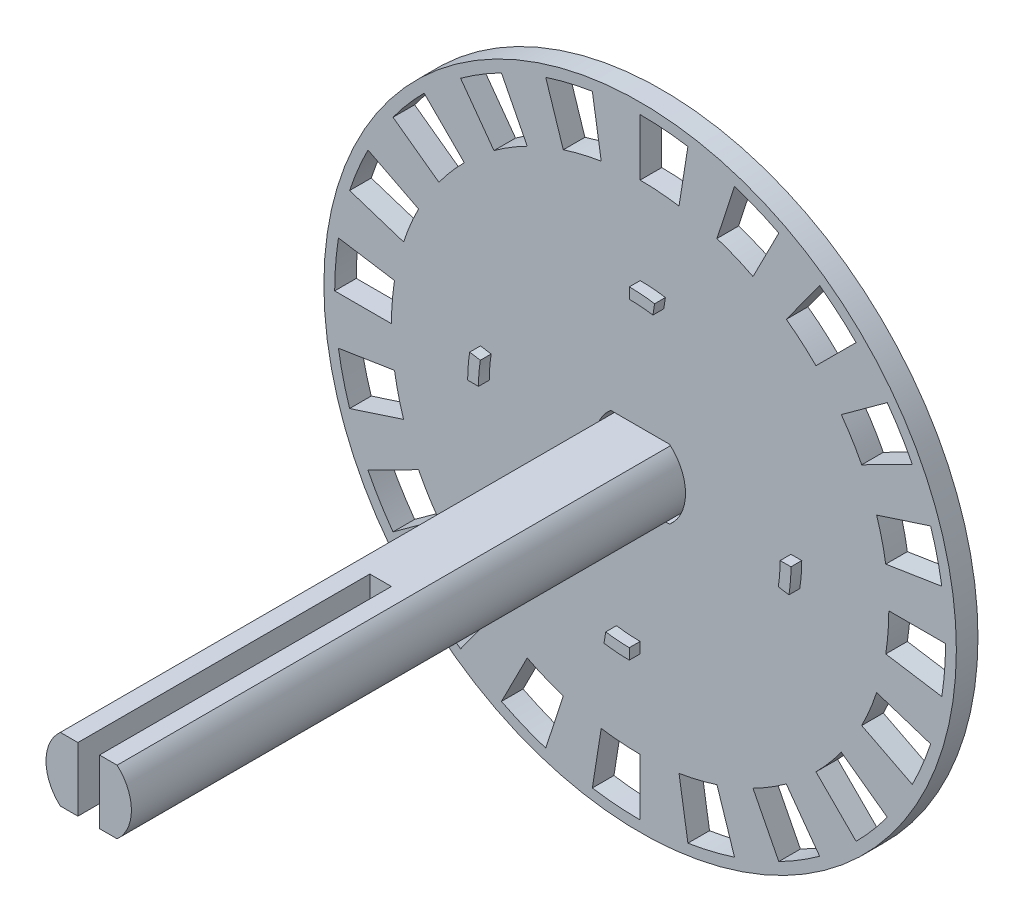
from build123d import *

# Parameters (mm, degrees)
SKETCH1_R             = 29.25
BOSS_EXTRUDE1_DEPTH   = 2
BOSS_EXTRUDE2_DEPTH   = 1
AXEL_START            = 17.516826032
AXEL_DEPTH            = 53
AXEL_2_OUTLINE_W      = 5.9
AXEL_2_OUTLINE_H      = 2
AXEL_2_DEPTH          = 26
BODY_MOVE_COPY2_ANGLE = 90
CUT_EXTRUDE1_DEPTH    = 10
CUT_EXTRUDE2_DEPTH    = 10


with BuildPart() as part:
    # Sketch1 → Boss-Extrude1 (new body)
    with BuildSketch(Plane.XY):
        Circle(SKETCH1_R)
    extrude(amount=BOSS_EXTRUDE1_DEPTH)

    # Sketch2 → Boss-Extrude2 (add)
    with BuildSketch(Plane.XY.offset(2)):
        with BuildLine():
            Line((0, 13.95), (0, 14.95))
            ThreePointArc((0, 14.95), (1.172963481, 14.903914139), (2.338695252, 14.765940692))
            Line((2.338695252, 14.765940692), (2.182260787, 13.778252351))
            ThreePointArc((2.182260787, 13.778252351), (1.094504385, 13.906996806), (0, 13.95))
        make_face()
        with BuildLine():
            Line((13.95, 0), (14.95, 0))
            ThreePointArc((14.95, 0), (14.903914139, -1.172963481), (14.765940692, -2.338695252))
            Line((14.765940692, -2.338695252), (13.778252351, -2.182260787))
            ThreePointArc((13.778252351, -2.182260787), (13.906996806, -1.094504385), (13.95, 0))
        make_face()
        with BuildLine():
            Line((0, -13.95), (0, -14.95))
            ThreePointArc((0, -14.95), (-1.172963481, -14.903914139), (-2.338695252, -14.765940692))
            Line((-2.338695252, -14.765940692), (-2.182260787, -13.778252351))
            ThreePointArc((-2.182260787, -13.778252351), (-1.094504385, -13.906996806), (0, -13.95))
        make_face()
        with BuildLine():
            Line((-13.95, 0), (-14.95, 0))
            ThreePointArc((-14.95, 0), (-14.903914139, 1.172963481), (-14.765940692, 2.338695252))
            Line((-14.765940692, 2.338695252), (-13.778252351, 2.182260787))
            ThreePointArc((-13.778252351, 2.182260787), (-13.906996806, 1.094504385), (-13.95, 0))
        make_face()
    extrude(amount=BOSS_EXTRUDE2_DEPTH)

    # Sketch3 → Cut-Extrude1 (cut)
    with BuildSketch(Plane(origin=(0, 0, 0), x_dir=(-1, 0, 0), z_dir=(0, 0, -1))):
        with BuildLine():
            Line((-2.720294102, 3.2), (2.720294102, 3.2))
            ThreePointArc((2.720294102, 3.2), (4.2, 0), (2.720294102, -3.2))
            Line((2.720294102, -3.2), (-2.720294102, -3.2))
            ThreePointArc((-2.720294102, -3.2), (-4.2, 0), (-2.720294102, 3.2))
        make_face()
    extrude(amount=-CUT_EXTRUDE1_DEPTH, mode=Mode.SUBTRACT)

    # Sketch4 → Cut-Extrude2 (cut)
    with BuildSketch(Plane.XY.offset(2)):
        with BuildLine():
            Line((0, 23), (0, 28.25))
            ThreePointArc((0, 28.25), (2.216469454, 28.162914678), (4.419273637, 27.902195622))
            Line((4.419273637, 27.902195622), (3.597992696, 22.716831834))
            ThreePointArc((3.597992696, 22.716831834), (1.804559202, 22.929098676), (0, 23))
        make_face()
        with BuildLine():
            Line((10.441781494, 20.493150056), (12.825231618, 25.170934308))
            ThreePointArc((12.825231618, 25.170934308), (10.810806964, 26.099596793), (8.729730091, 26.867346585))
            Line((8.729730091, 26.867346585), (7.107390871, 21.874299875))
            ThreePointArc((7.107390871, 21.874299875), (8.801718944, 21.249229248), (10.441781494, 20.493150056))
        make_face()
        with BuildLine():
            Line((16.263455967, 16.263455967), (19.975766569, 19.975766569))
            ThreePointArc((19.975766569, 19.975766569), (18.346907365, 21.481468528), (16.604933377, 22.854730091))
            Line((16.604933377, 22.854730091), (13.519060803, 18.607390871))
            ThreePointArc((13.519060803, 18.607390871), (14.937305112, 17.489337209), (16.263455967, 16.263455967))
        make_face()
        with BuildLine():
            Line((20.493150056, 10.441781494), (25.170934308, 12.825231618))
            ThreePointArc((25.170934308, 12.825231618), (24.087084643, 14.760584453), (22.854730091, 16.604933377))
            Line((22.854730091, 16.604933377), (18.607390871, 13.519060803))
            ThreePointArc((18.607390871, 13.519060803), (19.61072378, 12.017466988), (20.493150056, 10.441781494))
        make_face()
        with BuildLine():
            Line((22.716831834, 3.597992696), (27.902195622, 4.419273637))
            ThreePointArc((27.902195622, 4.419273637), (27.469450251, 6.594831529), (26.867346585, 8.729730091))
            Line((26.867346585, 8.729730091), (21.874299875, 7.107390871))
            ThreePointArc((21.874299875, 7.107390871), (22.364508169, 5.369243369), (22.716831834, 3.597992696))
        make_face()
        with BuildLine():
            Line((22.716831834, -3.597992696), (27.902195622, -4.419273637))
            ThreePointArc((27.902195622, -4.419273637), (28.162914678, -2.216469454), (28.25, 0))
            Line((28.25, 0), (23, 0))
            ThreePointArc((23, 0), (22.929098676, -1.804559202), (22.716831834, -3.597992696))
        make_face()
        with BuildLine():
            Line((20.493150056, -10.441781494), (25.170934308, -12.825231618))
            ThreePointArc((25.170934308, -12.825231618), (26.099596793, -10.810806964), (26.867346585, -8.729730091))
            Line((26.867346585, -8.729730091), (21.874299875, -7.107390871))
            ThreePointArc((21.874299875, -7.107390871), (21.249229248, -8.801718944), (20.493150056, -10.441781494))
        make_face()
        with BuildLine():
            Line((16.263455967, -16.263455967), (19.975766569, -19.975766569))
            ThreePointArc((19.975766569, -19.975766569), (21.481468528, -18.346907365), (22.854730091, -16.604933377))
            Line((22.854730091, -16.604933377), (18.607390871, -13.519060803))
            ThreePointArc((18.607390871, -13.519060803), (17.489337209, -14.937305112), (16.263455967, -16.263455967))
        make_face()
        with BuildLine():
            Line((10.441781494, -20.493150056), (12.825231618, -25.170934308))
            ThreePointArc((12.825231618, -25.170934308), (14.760584453, -24.087084643), (16.604933377, -22.854730091))
            Line((16.604933377, -22.854730091), (13.519060803, -18.607390871))
            ThreePointArc((13.519060803, -18.607390871), (12.017466988, -19.61072378), (10.441781494, -20.493150056))
        make_face()
        with BuildLine():
            Line((3.597992696, -22.716831834), (4.419273637, -27.902195622))
            ThreePointArc((4.419273637, -27.902195622), (6.594831529, -27.469450251), (8.729730091, -26.867346585))
            Line((8.729730091, -26.867346585), (7.107390871, -21.874299875))
            ThreePointArc((7.107390871, -21.874299875), (5.369243369, -22.364508169), (3.597992696, -22.716831834))
        make_face()
        with BuildLine():
            Line((-3.597992696, -22.716831834), (-4.419273637, -27.902195622))
            ThreePointArc((-4.419273637, -27.902195622), (-2.216469454, -28.162914678), (0, -28.25))
            Line((0, -28.25), (0, -23))
            ThreePointArc((0, -23), (-1.804559202, -22.929098676), (-3.597992696, -22.716831834))
        make_face()
        with BuildLine():
            Line((-10.441781494, -20.493150056), (-12.825231618, -25.170934308))
            ThreePointArc((-12.825231618, -25.170934308), (-10.810806964, -26.099596793), (-8.729730091, -26.867346585))
            Line((-8.729730091, -26.867346585), (-7.107390871, -21.874299875))
            ThreePointArc((-7.107390871, -21.874299875), (-8.801718944, -21.249229248), (-10.441781494, -20.493150056))
        make_face()
        with BuildLine():
            Line((-16.263455967, -16.263455967), (-19.975766569, -19.975766569))
            ThreePointArc((-19.975766569, -19.975766569), (-18.346907365, -21.481468528), (-16.604933377, -22.854730091))
            Line((-16.604933377, -22.854730091), (-13.519060803, -18.607390871))
            ThreePointArc((-13.519060803, -18.607390871), (-14.937305112, -17.489337209), (-16.263455967, -16.263455967))
        make_face()
        with BuildLine():
            Line((-20.493150056, -10.441781494), (-25.170934308, -12.825231618))
            ThreePointArc((-25.170934308, -12.825231618), (-24.087084643, -14.760584453), (-22.854730091, -16.604933377))
            Line((-22.854730091, -16.604933377), (-18.607390871, -13.519060803))
            ThreePointArc((-18.607390871, -13.519060803), (-19.61072378, -12.017466988), (-20.493150056, -10.441781494))
        make_face()
        with BuildLine():
            Line((-22.716831834, -3.597992696), (-27.902195622, -4.419273637))
            ThreePointArc((-27.902195622, -4.419273637), (-27.469450251, -6.594831529), (-26.867346585, -8.729730091))
            Line((-26.867346585, -8.729730091), (-21.874299875, -7.107390871))
            ThreePointArc((-21.874299875, -7.107390871), (-22.364508169, -5.369243369), (-22.716831834, -3.597992696))
        make_face()
        with BuildLine():
            Line((-22.716831834, 3.597992696), (-27.902195622, 4.419273637))
            ThreePointArc((-27.902195622, 4.419273637), (-28.162914678, 2.216469454), (-28.25, 0))
            Line((-28.25, 0), (-23, 0))
            ThreePointArc((-23, 0), (-22.929098676, 1.804559202), (-22.716831834, 3.597992696))
        make_face()
        with BuildLine():
            Line((-20.493150056, 10.441781494), (-25.170934308, 12.825231618))
            ThreePointArc((-25.170934308, 12.825231618), (-26.099596793, 10.810806964), (-26.867346585, 8.729730091))
            Line((-26.867346585, 8.729730091), (-21.874299875, 7.107390871))
            ThreePointArc((-21.874299875, 7.107390871), (-21.249229248, 8.801718944), (-20.493150056, 10.441781494))
        make_face()
        with BuildLine():
            Line((-16.263455967, 16.263455967), (-19.975766569, 19.975766569))
            ThreePointArc((-19.975766569, 19.975766569), (-21.481468528, 18.346907365), (-22.854730091, 16.604933377))
            Line((-22.854730091, 16.604933377), (-18.607390871, 13.519060803))
            ThreePointArc((-18.607390871, 13.519060803), (-17.489337209, 14.937305112), (-16.263455967, 16.263455967))
        make_face()
        with BuildLine():
            Line((-10.441781494, 20.493150056), (-12.825231618, 25.170934308))
            ThreePointArc((-12.825231618, 25.170934308), (-14.760584453, 24.087084643), (-16.604933377, 22.854730091))
            Line((-16.604933377, 22.854730091), (-13.519060803, 18.607390871))
            ThreePointArc((-13.519060803, 18.607390871), (-12.017466988, 19.61072378), (-10.441781494, 20.493150056))
        make_face()
        with BuildLine():
            Line((-3.597992696, 22.716831834), (-4.419273637, 27.902195622))
            ThreePointArc((-4.419273637, 27.902195622), (-6.594831529, 27.469450251), (-8.729730091, 26.867346585))
            Line((-8.729730091, 26.867346585), (-7.107390871, 21.874299875))
            ThreePointArc((-7.107390871, 21.874299875), (-5.369243369, 22.364508169), (-3.597992696, 22.716831834))
        make_face()
    extrude(amount=-CUT_EXTRUDE2_DEPTH, mode=Mode.SUBTRACT)


with BuildPart() as body_2:
    # Axel: read off the stored shape, not the designer's step
    # Axel outline → Axel (new body)
    with BuildSketch(Plane.YZ.offset(AXEL_START)):
        with BuildLine():
            Line((1.513004267, 20.746673909), (1.513004267, 22.373459016))
            ThreePointArc((1.513004267, 22.373459016), (-1.436995733, 23.696673909), (-4.386995733, 22.373459016))
            Line((-4.386995733, 22.373459016), (-4.386995733, 20.746673909))
            Line((-4.386995733, 20.746673909), (1.513004267, 20.746673909))
        make_face()
        with BuildLine():
            Line((1.513004267, 17.119888802), (1.513004267, 18.746673909))
            Line((1.513004267, 18.746673909), (-4.386995733, 18.746673909))
            Line((-4.386995733, 18.746673909), (-4.386995733, 17.119888802))
            ThreePointArc((-4.386995733, 17.119888802), (-1.436995733, 15.796673909), (1.513004267, 17.119888802))
        make_face()
    extrude(amount=AXEL_DEPTH)

    # Axel 2 outline → Axel 2 (add)
    with BuildSketch(Plane.YZ.offset(AXEL_START)):
        with Locations((-1.436995733, 19.746673909)):
            Rectangle(AXEL_2_OUTLINE_W, AXEL_2_OUTLINE_H)
    extrude(amount=AXEL_2_DEPTH)


with BuildPart() as body_2_1:
    # Body-Move/Copy2: read off the stored shape, not the designer's step
    # Body-Move/Copy2: moved
    add(body_2.part.moved(Location((-17.516826, 1.4369957, -19.7466739))).rotate(Axis((0, 0, 0), (0, -1, 0)), BODY_MOVE_COPY2_ANGLE))


solid = Compound([part.part, body_2_1.part])
